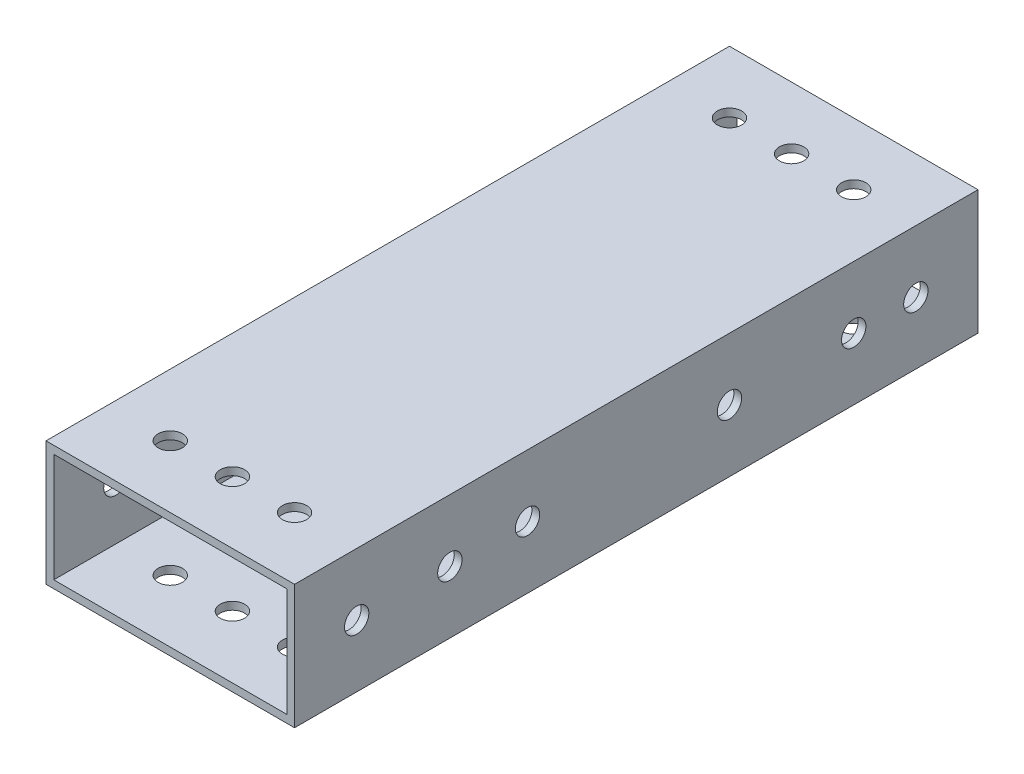
from build123d import *

# Parameters (mm, degrees)
SKETCH1_W           = 50.8
SKETCH1_H           = 25.4
SKETCH1_W_2         = 47.625
SKETCH1_H_2         = 22.225
BOSS_EXTRUDE1_DEPTH = 69.85
SKETCH2_R           = 2.4892
CUT_EXTRUDE1_DEPTH  = 79.545162168
SKETCH3_R           = 2.4892
CUT_EXTRUDE2_DEPTH  = 88.298066989


with BuildPart() as part:
    # Sketch1 → Boss-Extrude1 (new, symmetric)
    with BuildSketch(Plane.XY):
        Rectangle(SKETCH1_W, SKETCH1_H)
        Rectangle(SKETCH1_W_2, SKETCH1_H_2, mode=Mode.SUBTRACT)
    extrude(amount=BOSS_EXTRUDE1_DEPTH, both=True)

    # Sketch2 → Cut-Extrude1 (cut, through all)
    with BuildSketch(Plane(origin=(0, 12.7, 0), x_dir=(1, 0, 0), z_dir=(0, 1, 0))):
        with Locations((-12.7, 57.15)):
            Circle(SKETCH2_R)
        with Locations((0, 57.15)):
            Circle(SKETCH2_R)
        with Locations((12.7, 57.15)):
            Circle(SKETCH2_R)
        with Locations((12.7, -57.15)):
            Circle(SKETCH2_R)
        with Locations((0, -57.15)):
            Circle(SKETCH2_R)
        with Locations((-12.7, -57.15)):
            Circle(SKETCH2_R)
    extrude(amount=-CUT_EXTRUDE1_DEPTH, mode=Mode.SUBTRACT)

    # Sketch3 → Cut-Extrude2 (cut, through all)
    with BuildSketch(Plane(origin=(25.4, 0, 0), x_dir=(0, 0, -1), z_dir=(1, 0, 0))):
        with Locations((57.15, 0)):
            Circle(SKETCH3_R)
        with Locations((44.45, 0)):
            Circle(SKETCH3_R)
        with Locations((19.05, 0)):
            Circle(SKETCH3_R)
        with Locations((-57.15, 0)):
            Circle(SKETCH3_R)
        with Locations((-38.1, 0)):
            Circle(SKETCH3_R)
        with Locations((-22.225, 0)):
            Circle(SKETCH3_R)
    extrude(amount=-CUT_EXTRUDE2_DEPTH, mode=Mode.SUBTRACT)


solid = part.part
